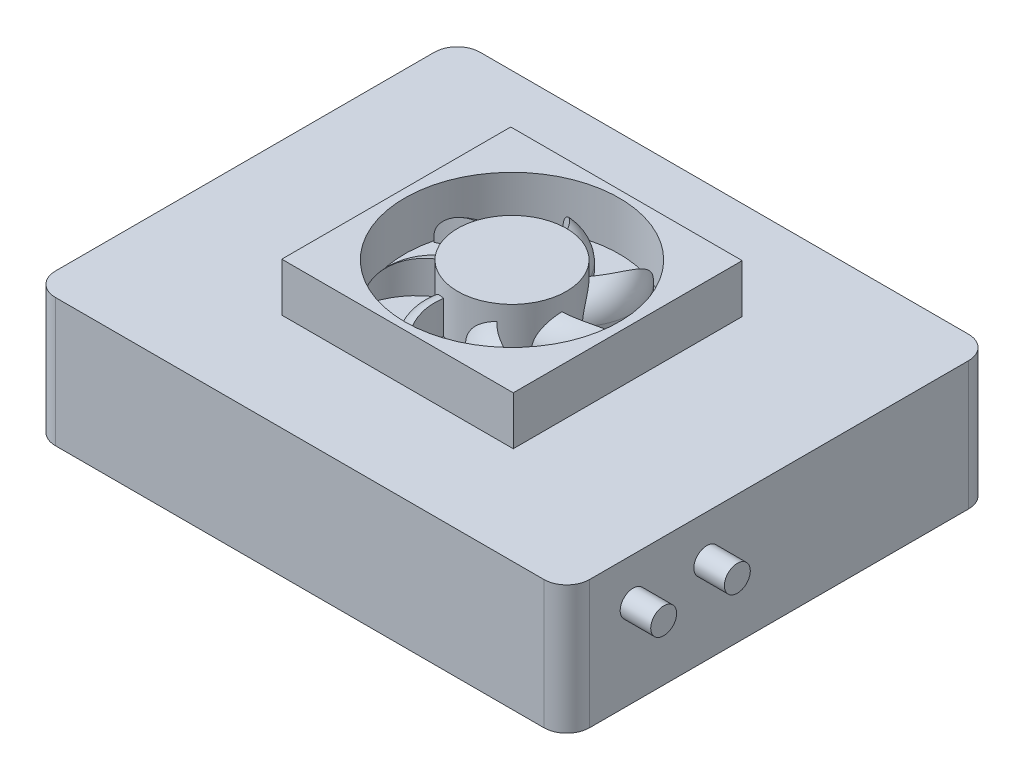
from build123d import *

# Parameters (mm, degrees)
SKETCH1_W           = 70
SKETCH1_H           = 55.65
BOSS_EXTRUDE1_DEPTH = 16.83
BOSS_EXTRUDE2_START = 16.83
SKETCH2_W           = 30.33
SKETCH2_H           = 30
BOSS_EXTRUDE2_DEPTH = 6.35
SKETCH3_R           = 14.055
BOSS_EXTRUDE3_DEPTH = 6.35
SKETCH4_R           = 14.055
CUT_EXTRUDE1_DEPTH  = 6.35
BOSS_EXTRUDE4_START = -35
SKETCH5_W           = 9.44
SKETCH5_H           = 4.86
BOSS_EXTRUDE4_DEPTH = 6.76
SKETCH6_R           = 1.7
BOSS_EXTRUDE5_DEPTH = 4
FILLET1_R           = 3
SKETCH7_R           = 7.14
BOSS_EXTRUDE6_DEPTH = 6.35
BOSS_EXTRUDE7_DEPTH = 4.35
FILLET3_R           = 3.5
CIRPATTERN11_COUNT  = 7
FILLET4_R           = 3.5


with BuildPart() as part:
    # Sketch1 → Boss-Extrude1 (new body)
    with BuildSketch(Plane(origin=(0, 0, 0), x_dir=(1, 0, 0), z_dir=(0, 1, 0))):
        Rectangle(SKETCH1_W, SKETCH1_H)
    extrude(amount=BOSS_EXTRUDE1_DEPTH)

    # Sketch2 → Boss-Extrude2 (add)
    with BuildSketch(Plane(origin=(0, 0, 0), x_dir=(1, 0, 0), z_dir=(0, 1, 0)).offset(BOSS_EXTRUDE2_START)):
        Rectangle(SKETCH2_W, SKETCH2_H)
    extrude(amount=BOSS_EXTRUDE2_DEPTH)

    # Sketch3 → Boss-Extrude3 (add)
    with BuildSketch(Plane(origin=(0, 23.18, 0), x_dir=(1, 0, 0), z_dir=(0, 1, 0))):
        Circle(SKETCH3_R)
    extrude(amount=-BOSS_EXTRUDE3_DEPTH)

    # Sketch4 → Cut-Extrude1 (cut)
    with BuildSketch(Plane(origin=(0, 23.18, 0), x_dir=(1, 0, 0), z_dir=(0, 1, 0))):
        with Locations(Location((0, 0, 0), (0, 0, 270))):
            Circle(SKETCH4_R)
    extrude(amount=-CUT_EXTRUDE1_DEPTH, mode=Mode.SUBTRACT)

    # Sketch5 → Boss-Extrude4 (add)
    with BuildSketch(Plane(origin=(0, 0, 0), x_dir=(0, 0, -1), z_dir=(1, 0, 0)).offset(BOSS_EXTRUDE4_START)):
        with Locations((18.775, 6.43)):
            Rectangle(SKETCH5_W, SKETCH5_H)
    extrude(amount=-BOSS_EXTRUDE4_DEPTH)

    # Sketch6 → Boss-Extrude5 (add)
    with BuildSketch(Plane(origin=(35, 0, 0), x_dir=(0, 0, -1), z_dir=(1, 0, 0))):
        with Locations(Location((-19.125364984, 11.29, 0), (0, 0, 180))):
            Circle(SKETCH6_R)
        with Locations(Location((-9.475364984, 11.29, 0), (0, 0, 180))):
            Circle(SKETCH6_R)
    extrude(amount=BOSS_EXTRUDE5_DEPTH)

    # Fillet1
    fillet1_edges = [part.edges().sort_by_distance(p)[0] for p in [
        (-35, 8.415, -27.825),
        (35, 8.415, -27.825),
        (35, 8.415, 27.825),
        (-35, 8.415, 27.825),
    ]]
    fillet(fillet1_edges, radius=FILLET1_R)

    # Sketch7 → Boss-Extrude6 (add)
    with BuildSketch(Plane(origin=(0, 16.83, 0), x_dir=(1, 0, 0), z_dir=(0, 1, 0))):
        with Locations(Location((0, 0, 0), (0, 0, 270))):
            Circle(SKETCH7_R)
    extrude(amount=BOSS_EXTRUDE6_DEPTH)

    # Sketch11 → Boss-Extrude7 (add)
    with BuildSketch(Plane(origin=(0, 16.83, 0), x_dir=(1, 0, 0), z_dir=(0, 1, 0))):
        with BuildLine():
            ThreePointArc((7.116145586, -0.583156929), (6.803943672, -2.164705639), (6.144899887, -3.635905029))
            ThreePointArc((6.144899887, -3.635905029), (11.187164412, -1.887909247), (13.51656418, 2.913529862))
            ThreePointArc((13.51656418, 2.913529862), (10.713284894, 0.438636341), (7.116145586, -0.583156929))
        make_face()
    boss_extrude7 = extrude(amount=BOSS_EXTRUDE7_DEPTH)

    # Fillet3
    # the kernel refuses this fillet: 3.5 mm, written as the material it takes off along each edge
    with BuildSketch(Plane(origin=(6.556014588, 21.18, -3.324644563), x_dir=(-0.9673093233437143, 0, 0.25359943409307006), z_dir=(-0.25359943409307006, 0, -0.9673093233437143))) as fillet3_piece_1_section:
        with BuildLine():
            CenterArc((6.972679966 - FILLET3_R, -FILLET3_R), FILLET3_R, 0, 90)
            Line((6.972679966 - FILLET3_R, 0), (6.972679966, 0))
            Line((6.972679966, 0), (6.972679966, -FILLET3_R))
        make_face()
    fillet3_piece_1 = revolve(axis=Axis((6.556014588, 21.18, -3.324644563), (0, 1, 0)), revolution_arc=233.858448906, mode=Mode.PRIVATE)
    fillet3_piece_1 = fillet3_piece_1 - Plane(origin=(0, 20.294110175, 0), x_dir=(0, 0, 1), z_dir=(0, -1, 0)) * Cylinder(7.14, 28, mode=Mode.PRIVATE)
    fillet3_piece_1 = fillet3_piece_1 - Plane(origin=(6.664387144, 20.294110175, -7.849834998), x_dir=(0.8113805957786566, 0, 0.5845182022776301), z_dir=(0, -1, 0)) * Cylinder(8.445083689, 28, mode=Mode.PRIVATE)
    add(fillet3_piece_1, mode=Mode.SUBTRACT)

    # CirPattern11: Boss-Extrude7 ×7 about axis
    cirpattern11_axis = Axis((0, 0, 0), (0, 1, 0))
    for i in range(1, CIRPATTERN11_COUNT):
        add(boss_extrude7.rotate(cirpattern11_axis, i * 360 / CIRPATTERN11_COUNT))

    # Fillet4
    # the kernel refuses this fillet: 3.5 mm, written as the material it takes off along each edge
    with BuildSketch(Plane(origin=(6.686920024, 21.18, 3.052816625), x_dir=(-0.8013795198577165, 0, -0.5981562213607877), z_dir=(0.5981562213607877, 0, -0.8013795198577165))) as fillet4_piece_1_section:
        with BuildLine():
            CenterArc((6.972679966 - FILLET4_R, -FILLET4_R), FILLET4_R, 0, 90)
            Line((6.972679966 - FILLET4_R, 0), (6.972679966, 0))
            Line((6.972679966, 0), (6.972679966, -FILLET4_R))
        make_face()
    fillet4_piece_1 = revolve(axis=Axis((6.686920024, 21.18, 3.052816625), (0, 1, 0)), revolution_arc=233.858448906, mode=Mode.PRIVATE)
    fillet4_piece_1 = fillet4_piece_1 - Plane(origin=(0, 20.294110175, 0), x_dir=(0, 0, 1), z_dir=(0, -1, 0)) * Cylinder(7.14, 28, mode=Mode.PRIVATE)
    fillet4_piece_1 = fillet4_piece_1 - Plane(origin=(10.292425554, 20.294110175, 0.316135614), x_dir=(0.04889279427778842, 0, 0.998804032164323), z_dir=(0, -1, 0)) * Cylinder(8.445083689, 28, mode=Mode.PRIVATE)
    add(fillet4_piece_1, mode=Mode.SUBTRACT)
    with BuildSketch(Plane(origin=(1.782438293, 21.18, 7.131444628), x_dir=(-0.0319945927557557, 0, -0.9994880419666827), z_dir=(0.9994880419666827, 0, -0.0319945927557557))) as fillet4_piece_2_section:
        with BuildLine():
            CenterArc((6.972679966 - FILLET4_R, -FILLET4_R), FILLET4_R, 0, 90)
            Line((6.972679966 - FILLET4_R, 0), (6.972679966, 0))
            Line((6.972679966, 0), (6.972679966, -FILLET4_R))
        make_face()
    fillet4_piece_2 = revolve(axis=Axis((1.782438293, 21.18, 7.131444628), (0, 1, 0)), revolution_arc=233.858448906, mode=Mode.PRIVATE)
    fillet4_piece_2 = fillet4_piece_2 & Plane(origin=(0, 20.294110175, 0), x_dir=(0, 0, 1), z_dir=(0, 1, 0)) * Cylinder(14.055, 28, mode=Mode.PRIVATE)
    fillet4_piece_2 = fillet4_piece_2 - Plane(origin=(0, 20.294110175, 0), x_dir=(0, 0, 1), z_dir=(0, -1, 0)) * Cylinder(7.14, 28, mode=Mode.PRIVATE)
    add(fillet4_piece_2, mode=Mode.SUBTRACT)
    with BuildSketch(Plane(origin=(-4.464255827, 21.18, 5.839949371), x_dir=(0.7614829152620437, 0, -0.6481849811311732), z_dir=(0.6481849811311732, 0, 0.7614829152620437))) as fillet4_piece_3_section:
        with BuildLine():
            CenterArc((6.972679966 - FILLET4_R, -FILLET4_R), FILLET4_R, 0, 90)
            Line((6.972679966 - FILLET4_R, 0), (6.972679966, 0))
            Line((6.972679966, 0), (6.972679966, -FILLET4_R))
        make_face()
    fillet4_piece_3 = revolve(axis=Axis((-4.464255827, 21.18, 5.839949371), (0, 1, 0)), revolution_arc=233.858448906, mode=Mode.PRIVATE)
    fillet4_piece_3 = fillet4_piece_3 & Plane(origin=(0, 20.294110175, 0), x_dir=(0, 0, 1), z_dir=(0, 1, 0)) * Cylinder(14.055, 28, mode=Mode.PRIVATE)
    fillet4_piece_3 = fillet4_piece_3 - Plane(origin=(0, 20.294110175, 0), x_dir=(0, 0, 1), z_dir=(0, -1, 0)) * Cylinder(7.14, 28, mode=Mode.PRIVATE)
    add(fillet4_piece_3, mode=Mode.SUBTRACT)
    with BuildSketch(Plane(origin=(-7.349274256, 21.18, 0.150853125), x_dir=(0.9815482566668393, 0, 0.19121459106011865), z_dir=(-0.19121459106011865, 0, 0.9815482566668393))) as fillet4_piece_4_section:
        with BuildLine():
            CenterArc((6.972679966 - FILLET4_R, -FILLET4_R), FILLET4_R, 0, 90)
            Line((6.972679966 - FILLET4_R, 0), (6.972679966, 0))
            Line((6.972679966, 0), (6.972679966, -FILLET4_R))
        make_face()
    fillet4_piece_4 = revolve(axis=Axis((-7.349274256, 21.18, 0.150853125), (0, 1, 0)), revolution_arc=233.858448906, mode=Mode.PRIVATE)
    fillet4_piece_4 = fillet4_piece_4 & Plane(origin=(0, 20.294110175, 0), x_dir=(0, 0, 1), z_dir=(0, 1, 0)) * Cylinder(14.055, 28, mode=Mode.PRIVATE)
    fillet4_piece_4 = fillet4_piece_4 - Plane(origin=(0, 20.294110175, 0), x_dir=(0, 0, 1), z_dir=(0, -1, 0)) * Cylinder(7.14, 28, mode=Mode.PRIVATE)
    add(fillet4_piece_4, mode=Mode.SUBTRACT)
    with BuildSketch(Plane(origin=(-4.700139271, 21.18, -5.651838602), x_dir=(0.4624877408659423, 0, 0.8866256761163174), z_dir=(-0.8866256761163174, 0, 0.4624877408659423))) as fillet4_piece_5_section:
        with BuildLine():
            CenterArc((6.972679966 - FILLET4_R, -FILLET4_R), FILLET4_R, 0, 90)
            Line((6.972679966 - FILLET4_R, 0), (6.972679966, 0))
            Line((6.972679966, 0), (6.972679966, -FILLET4_R))
        make_face()
    fillet4_piece_5 = revolve(axis=Axis((-4.700139271, 21.18, -5.651838602), (0, 1, 0)), revolution_arc=233.858448906, mode=Mode.PRIVATE)
    fillet4_piece_5 = fillet4_piece_5 & Plane(origin=(0, 20.294110175, 0), x_dir=(0, 0, 1), z_dir=(0, 1, 0)) * Cylinder(14.055, 28, mode=Mode.PRIVATE)
    fillet4_piece_5 = fillet4_piece_5 - Plane(origin=(0, 20.294110175, 0), x_dir=(0, 0, 1), z_dir=(0, -1, 0)) * Cylinder(7.14, 28, mode=Mode.PRIVATE)
    add(fillet4_piece_5, mode=Mode.SUBTRACT)
    with BuildSketch(Plane(origin=(1.488296449, 21.18, -7.198580584), x_dir=(-0.4048354768376397, 0, 0.9143895431891382), z_dir=(-0.9143895431891382, 0, -0.4048354768376397))) as fillet4_piece_6_section:
        with BuildLine():
            CenterArc((6.972679966 - FILLET4_R, -FILLET4_R), FILLET4_R, 0, 90)
            Line((6.972679966 - FILLET4_R, 0), (6.972679966, 0))
            Line((6.972679966, 0), (6.972679966, -FILLET4_R))
        make_face()
    fillet4_piece_6 = revolve(axis=Axis((1.488296449, 21.18, -7.198580584), (0, 1, 0)), revolution_arc=233.858448906, mode=Mode.PRIVATE)
    fillet4_piece_6 = fillet4_piece_6 & Plane(origin=(0, 20.294110175, 0), x_dir=(0, 0, 1), z_dir=(0, 1, 0)) * Cylinder(14.055, 28, mode=Mode.PRIVATE)
    fillet4_piece_6 = fillet4_piece_6 - Plane(origin=(0, 20.294110175, 0), x_dir=(0, 0, 1), z_dir=(0, -1, 0)) * Cylinder(7.14, 28, mode=Mode.PRIVATE)
    add(fillet4_piece_6, mode=Mode.SUBTRACT)


solid = part.part
